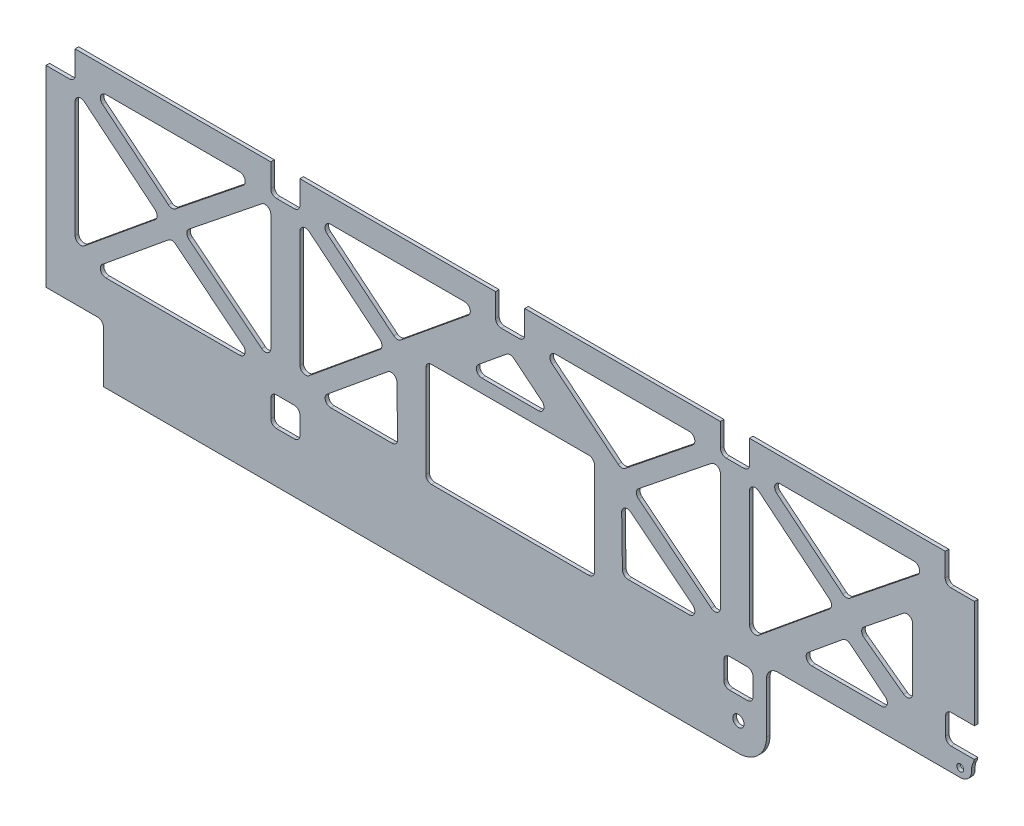
from build123d import *

# Parameters (mm, degrees)
CROQUIS1_W            = 1652
CROQUIS1_H            = 800
BRIDA_BASE1_DEPTH     = 6.35
CROQUIS14_W           = 51.8
CROQUIS14_H           = 51.8
CROQUIS14_W_2         = 63.126519035
CORTAR_EXTRUIR1_DEPTH = 1219.164820759
REDONDEO1_R           = 10
CORTAR_EXTRUIR2_DEPTH = 10
CROQUIS16_W           = 1851.772717955
CROQUIS16_H           = 646.832690835
CORTAR_EXTRUIR3_DEPTH = 10
CROQUIS22_W           = 370
CROQUIS22_H           = 160
CROQUIS22_W_2         = 5
CROQUIS22_H_2         = 30
CORTAR_EXTRUIR4_DEPTH = 10
REDONDEO2_R           = 50
REDONDEO4_R           = 20
CROQUIS24_R           = 10
CROQUIS24_R_2         = 6.1
CORTAR_EXTRUIR5_DEPTH = 10
CROQUIS26_W           = 51.8
CROQUIS26_H           = 51.8
CROQUIS26_W_2         = 102.1
CROQUIS26_H_2         = 102.1
CORTAR_EXTRUIR6_DEPTH = 10
CROQUIS27_W           = 300
CROQUIS27_H           = 185
CORTAR_EXTRUIR7_DEPTH = 10
REDONDEO5_R           = 10
REDONDEO6_R           = 20
CROQUIS28_W           = 1630.728346653
CROQUIS28_H           = 78.930224798
CORTAR_EXTRUIR8_DEPTH = 10


# Sheet-metal steps are written as plain solids
with BuildPart() as part:
    # Brida base1: sheet metal written as solids
    # Croquis1 → Brida base1 (new body)
    with BuildSketch(Plane.XY):
        with Locations((191.278244715, -270.097142857)):
            Rectangle(CROQUIS1_W, CROQUIS1_H)
    extrude(amount=-BRIDA_BASE1_DEPTH)

    # Croquis14 → Cortar-Extruir1 (cut, through all)
    with BuildSketch(Plane.XY.offset(-6.35)):
        with Locations((-608.821755285, -200.097142857)):
            Rectangle(CROQUIS14_W, CROQUIS14_H)
        with Locations((996.841504233, -200.097142857)):
            Rectangle(CROQUIS14_W_2, CROQUIS14_H)
        with Locations((-208.821755285, -200.097142857)):
            Rectangle(CROQUIS14_W, CROQUIS14_H)
        with Locations((191.178244715, -200.097142857)):
            Rectangle(CROQUIS14_W, CROQUIS14_H)
        Polygon((565.278244715, 79.002857143), (589.278244715, 79.002857143), (617.078244715, 79.002857143), (617.078244715, 130.802857143), (565.278244715, 130.802857143), align=None)
        with Locations((591.178244715, -200.097142857)):
            Rectangle(CROQUIS14_W, CROQUIS14_H)
        with Locations((191.178244715, 104.902857143)):
            Rectangle(CROQUIS14_W, CROQUIS14_H)
        Polygon((-451.257262437, -29.957955428), (-582.921755285, 78.102857143), (-582.921755285, -138.018768), align=None)
        Polygon((-268.914894276, 94.902857143), (-556.103809482, 94.902857143), (-410.721755285, -24.416350109), align=None)
        Polygon((-234.721755285, -174.028415053), (-234.721755285, 31.662574085), (-327.677719189, -27.178551066), align=None)
        Polygon((768.774847287, -46.398880447), (617.078244713, 78.102857143), (617.078244713, -170.900618037), align=None)
        Polygon((-8.919965411, -500.304093217), (-10.721755286, -380.984885965), (-156.103809483, -500.304093217), align=None)
        Polygon((538.26387866, -500.304093217), (389.278244713, -380.984885965), (391.080034588, -500.304093217), align=None)
        Polygon((269.411457139, -319.997142857), (191.178244715, -255.997142857), (112.945032291, -319.997142857), align=None)
        with Locations((-208.821755285, 104.902857143)):
            Rectangle(CROQUIS14_W, CROQUIS14_H)
        Polygon((-31.225152712, -46.398880447), (-182.921755286, 78.102857143), (-182.921755286, -174.028415053), align=None)
        Polygon((138.263878661, 94.902857143), (-156.103809483, 94.902857143), (-10.721755286, -24.416350109), align=None)
        Polygon((165.278244714, -170.900618037), (165.278244714, 78.102857143), (9.821543906, -46.398880447), align=None)
        Polygon((368.774847287, -46.398880447), (217.078244713, 78.102857143), (217.078244713, -170.900618037), align=None)
        Polygon((538.26387866, 94.902857143), (243.896190516, 94.902857143), (389.278244713, -24.416350109), align=None)
        Polygon((565.278244713, -170.900618037), (565.278244713, 78.102857143), (409.821543905, -46.398880447), align=None)
        Polygon((938.263878659, 94.902857143), (643.896190515, 94.902857143), (789.278244712, -24.416350109), align=None)
        Polygon((965.278244712, -170.900618037), (965.278244712, 78.102857143), (809.821543904, -46.398880447), align=None)
        Polygon((-31.225152712, -359.002355627), (-182.921755286, -234.500618037), (-182.921755286, -483.504093217), align=None)
        Polygon((138.263878661, -217.700618037), (-156.103809483, -217.700618037), (-9.474610603, -338.560583004), align=None)
        Polygon((538.250119108, -217.71743763), (243.882430964, -217.71743763), (389.454315029, -336.804974642), align=None)
        Polygon((565.278244713, -483.504093217), (565.278244713, -234.500618037), (409.821543905, -359.002355627), align=None)
        Polygon((768.774847286, -359.002355627), (617.078244712, -234.500618037), (617.078244712, -483.504093217), align=None)
        Polygon((938.263878659, -217.700618037), (643.896190515, -217.700618037), (789.278244712, -337.019825289), align=None)
        Polygon((907.278244715, -443.723513221), (907.278244715, -294.399941382), (810.207961961, -372.141324085), align=None)
        Polygon((880.811903419, -470.097142857), (789.278244712, -396.789916486), (699.958550064, -470.097142857), align=None)
        Polygon((-431.225152711, -359.002355627), (-582.921755285, -234.500618037), (-582.921755285, -483.504093217), align=None)
        Polygon((-261.736121338, -217.700618037), (-556.103809482, -217.700618037), (-410.721755285, -337.019825289), align=None)
        Polygon((-234.721755285, -483.504093217), (-234.721755285, -234.500618037), (-390.178456093, -359.002355627), align=None)
        Polygon((-261.736121338, -500.304093217), (-410.721755285, -380.984885965), (-556.103809482, -500.304093217), align=None)
    extrude(amount=CORTAR_EXTRUIR1_DEPTH, mode=Mode.SUBTRACT)

    # Redondeo1
    redondeo1_edges = [part.edges().sort_by_distance(p)[0] for p in [
        (-10.721755286, -24.416350109, -3.175),
        (138.263878661, 94.902857143, -3.175),
        (-156.103809483, 94.902857143, -3.175),
        (9.821543906, -46.398880447, -3.175),
        (165.278244714, -170.900618037, -3.175),
        (165.278244714, 78.102857143, -3.175),
        (-9.474610603, -338.560583004, -3.175),
        (138.263878661, -217.700618037, -3.175),
        (-156.103809483, -217.700618037, -3.175),
        (-156.103809483, -500.304093217, -3.175),
        (-31.225152712, -359.002355627, -3.175),
        (-182.921755286, -234.500618037, -3.175),
        (-182.921755286, -483.504093217, -3.175),
        (-390.178456093, -359.002355627, -3.175),
        (-234.721755285, -483.504093217, -3.175),
        (-234.721755285, -234.500618037, -3.175),
        (-410.721755285, -337.019825289, -3.175),
        (-261.736121338, -217.700618037, -3.175),
        (-556.103809482, -217.700618037, -3.175),
        (-410.721755285, -24.416350109, -3.175),
        (-556.103809482, -500.304093217, -3.175),
        (-261.736121338, -500.304093217, -3.175),
        (-410.721755285, -380.984885965, -3.175),
        (-268.914894276, 94.902857143, -3.175),
        (-556.103809482, 94.902857143, -3.175),
        (389.454315029, -336.804974642, -3.175),
        (538.250119108, -217.71743763, -3.175),
        (243.882430964, -217.71743763, -3.175),
        (409.821543905, -359.002355627, -3.175),
        (565.278244713, -483.504093217, -3.175),
        (565.278244713, -234.500618037, -3.175),
        (538.26387866, -500.304093217, -3.175),
        (409.821543905, -46.398880447, -3.175),
        (565.278244713, -170.900618037, -3.175),
        (565.278244713, 78.102857143, -3.175),
        (389.278244713, -24.416350109, -3.175),
        (538.26387866, 94.902857143, -3.175),
        (243.896190516, 94.902857143, -3.175),
        (789.278244712, -24.416350109, -3.175),
        (938.263878659, 94.902857143, -3.175),
        (643.896190515, 94.902857143, -3.175),
        (809.821543904, -46.398880447, -3.175),
        (965.278244712, -170.900618037, -3.175),
        (965.278244712, 78.102857143, -3.175),
        (-431.225152711, -359.002355627, -3.175),
        (-582.921755285, -234.500618037, -3.175),
        (-582.921755285, -483.504093217, -3.175),
        (768.774847286, -359.002355627, -3.175),
        (617.078244712, -234.500618037, -3.175),
        (617.078244712, -483.504093217, -3.175),
        (-451.257262437, -29.957955428, -3.175),
        (789.278244712, -337.019825289, -3.175),
        (938.263878659, -217.700618037, -3.175),
        (643.896190515, -217.700618037, -3.175),
        (-582.921755285, 78.102857143, -3.175),
        (-582.921755285, -138.018768, -3.175),
        (699.958550064, -470.097142857, -3.175),
        (880.811903419, -470.097142857, -3.175),
        (789.278244712, -396.789916486, -3.175),
        (368.774847287, -46.398880447, -3.175),
        (217.078244713, 78.102857143, -3.175),
        (217.078244713, -170.900618037, -3.175),
        (965.278244715, -225.997142857, -3.175),
        (617.078244713, -170.900618037, -3.175),
        (768.774847287, -46.398880447, -3.175),
        (617.078244713, 78.102857143, -3.175),
        (-327.677719189, -27.178551066, -3.175),
        (-234.721755285, -174.028415053, -3.175),
        (-234.721755285, 31.662574085, -3.175),
        (269.411457139, -319.997142857, -3.175),
        (191.178244715, -255.997142857, -3.175),
        (112.945032291, -319.997142857, -3.175),
        (-234.721755285, -225.997142857, -3.175),
        (907.278244715, -294.399941382, -3.175),
        (-182.921755285, -225.997142857, -3.175),
        (810.207961961, -372.141324085, -3.175),
        (907.278244715, -443.723513221, -3.175),
        (165.278244715, -225.997142857, -3.175),
        (217.078244715, -225.997142857, -3.175),
        (565.278244715, -225.997142857, -3.175),
        (617.078244715, -225.997142857, -3.175),
        (-582.921755285, -225.997142857, -3.175),
        (-31.225152712, -46.398880447, -3.175),
        (-182.921755286, 78.102857143, -3.175),
        (-182.921755286, -174.028415053, -3.175),
    ]]
    fillet(redondeo1_edges, radius=REDONDEO1_R)

    # Croquis15 → Cortar-Extruir2 (cut)
    with BuildSketch(Plane(origin=(0, 0, -6.35), x_dir=(-1, 0, 0), z_dir=(0, 0, -1))):
        Polygon((234.721755285, 79.002857143), (634.721755285, -174.197142857), (723.595264546, -174.197142857), (723.595264546, 158.524082489), (234.721755285, 158.524082489), align=None)
    extrude(amount=-CORTAR_EXTRUIR2_DEPTH, mode=Mode.SUBTRACT)

    # Croquis16 → Cortar-Extruir3 (cut)
    with BuildSketch(Plane(origin=(0, 0, -6.35), x_dir=(-1, 0, 0), z_dir=(0, 0, -1))):
        with Locations((-91.391885737, 149.219202561)):
            Rectangle(CROQUIS16_W, CROQUIS16_H)
    extrude(amount=-CORTAR_EXTRUIR3_DEPTH, mode=Mode.SUBTRACT)

    # Croquis22 → Cortar-Extruir4 (cut)
    with BuildSketch(Plane(origin=(0, 0, 0), x_dir=(-1, 0, 0), z_dir=(0, 0, -1))):
        with Locations((-832.278244715, -590.097142857)):
            Rectangle(CROQUIS22_W, CROQUIS22_H)
        with Locations((-1014.778244715, -495.097142857)):
            Rectangle(CROQUIS22_W_2, CROQUIS22_H_2)
    extrude(amount=CORTAR_EXTRUIR4_DEPTH, mode=Mode.SUBTRACT)

    # Redondeo2
    redondeo2_edges = [part.edges().sort_by_distance(p)[0] for p in [
        (647.278244715, -670.097142857, -3.175),
    ]]
    fillet(redondeo2_edges, radius=REDONDEO2_R)

    # Redondeo4
    # the kernel refuses this fillet: 20 mm, written as the material it adds along each edge
    with BuildSketch(Plane(origin=(647.278244715, -510.097142857, 0), x_dir=(0, -1, 0), z_dir=(0, 0, -1))) as redondeo4_piece_1:
        with BuildLine():
            CenterArc((REDONDEO4_R, -REDONDEO4_R), REDONDEO4_R, 90, 90)
            Line((0, -REDONDEO4_R), (0, 0))
            Line((0, 0), (REDONDEO4_R, 0))
        make_face()
    extrude(amount=6.35)
    # the kernel refuses this fillet: 20 mm, written as the material it takes off along each edge
    with BuildSketch(Plane(origin=(-634.721755285, -670.097142857, 50), x_dir=(1, 0, 0), z_dir=(0, 0, -1))) as redondeo4_2_piece_1:
        with BuildLine():
            CenterArc((REDONDEO4_R, -REDONDEO4_R), REDONDEO4_R, 90, 90)
            Line((0, -REDONDEO4_R), (0, 0))
            Line((0, 0), (REDONDEO4_R, 0))
        make_face()
    extrude(amount=106.35, mode=Mode.SUBTRACT)
    with BuildSketch(Plane(origin=(1017.278244715, -480.097142857, 33.071891388), x_dir=(-1, 0, 0), z_dir=(0, 0, -1))) as redondeo4_2_piece_2:
        with BuildLine():
            CenterArc((20, 13.228756555), REDONDEO4_R, 180, 41.409622109)
            Line((0, 13.228756555), (0, 0))
            Line((0, 0), (5, 0))
        make_face()
    extrude(amount=72.493782777, mode=Mode.SUBTRACT)
    with BuildSketch(Plane(origin=(1012.278244715, -510.097142857, 50), x_dir=(-1, 0, 0), z_dir=(0, 0, -1))) as redondeo4_2_piece_3:
        with BuildLine():
            CenterArc((REDONDEO4_R, REDONDEO4_R), REDONDEO4_R, 180, 90)
            Line((0, REDONDEO4_R), (0, 0))
            Line((0, 0), (REDONDEO4_R, 0))
        make_face()
    extrude(amount=106.35, mode=Mode.SUBTRACT)

    # Croquis24 → Cortar-Extruir5 (cut)
    with BuildSketch(Plane.XY):
        with Locations((597.278244715, -620.097142857)):
            Circle(CROQUIS24_R)
        with Locations((991.878244715, -495.097142857)):
            Circle(CROQUIS24_R_2)
    extrude(amount=-CORTAR_EXTRUIR5_DEPTH, mode=Mode.SUBTRACT)

    # Croquis26 → Cortar-Extruir6 (cut)
    with BuildSketch(Plane.XY):
        with Locations((597.278244715, -554.697142857)):
            Rectangle(CROQUIS26_W, CROQUIS26_H)
        with Locations((991.878244715, -443.737142857)):
            Rectangle(CROQUIS26_W, CROQUIS26_H)
        with Locations((-208.821755285, -554.697142857)):
            Rectangle(CROQUIS26_W, CROQUIS26_H)
        with Locations((-583.671755285, -619.047142857)):
            Rectangle(CROQUIS26_W_2, CROQUIS26_H_2)
    extrude(amount=-CORTAR_EXTRUIR6_DEPTH, mode=Mode.SUBTRACT)

    # Croquis27 → Cortar-Extruir7 (cut)
    with BuildSketch(Plane.XY):
        with Locations((191.178244715, -436.297142857)):
            Rectangle(CROQUIS27_W, CROQUIS27_H)
    extrude(amount=-CORTAR_EXTRUIR7_DEPTH, mode=Mode.SUBTRACT)

    # Redondeo5
    redondeo5_edges = [part.edges().sort_by_distance(p)[0] for p in [
        (623.178244715, -528.797142857, -3.175),
        (623.178244715, -580.597142857, -3.175),
        (571.378244715, -580.597142857, -3.175),
        (571.378244715, -528.797142857, -3.175),
        (965.978244715, -469.637142857, -3.175),
        (965.978244715, -417.837142857, -3.175),
        (-182.921755285, -528.797142857, -3.175),
        (-182.921755285, -580.597142857, -3.175),
        (-234.721755285, -580.597142857, -3.175),
        (-234.721755285, -528.797142857, -3.175),
        (-532.621755285, -567.997142857, -3.175),
        (41.178244715, -528.797142857, -3.175),
        (41.178244715, -343.797142857, -3.175),
        (341.178244715, -343.797142857, -3.175),
        (341.178244715, -528.797142857, -3.175),
        (-8.919965411, -500.304093217, -3.175),
        (-10.721755286, -380.984885965, -3.175),
        (391.080034588, -500.304093217, -3.175),
        (389.278244713, -380.984885965, -3.175),
    ]]
    fillet(redondeo5_edges, radius=REDONDEO5_R)

    # Redondeo6
    redondeo6_edges = [part.edges().sort_by_distance(p)[0] for p in [
        (1012.278244715, -480.097142857, -3.175),
    ]]
    fillet(redondeo6_edges, radius=REDONDEO6_R)

    # Croquis28 → Cortar-Extruir8 (cut)
    with BuildSketch(Plane.XY):
        with Locations((197.722953754, -135.232030458)):
            Rectangle(CROQUIS28_W, CROQUIS28_H)
    extrude(amount=-CORTAR_EXTRUIR8_DEPTH, mode=Mode.SUBTRACT)


solid = part.part
